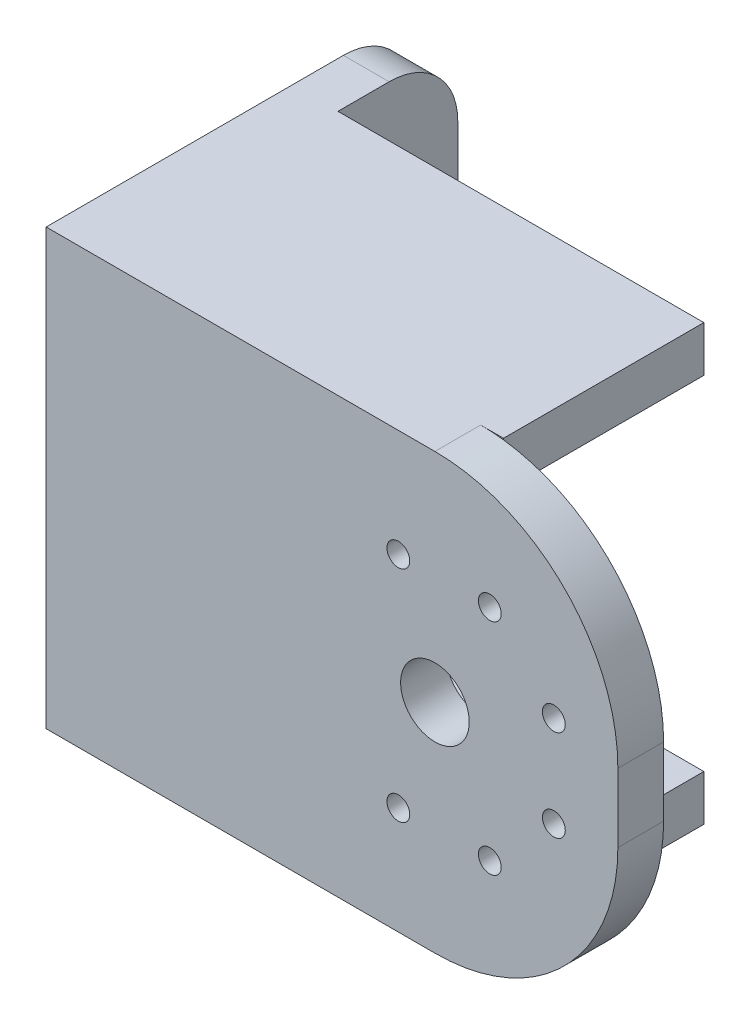
from build123d import *

# Parameters (mm, degrees)
SKETCH3_R           = 7.5
SKETCH3_R_2         = 2.5
BOSS_EXTRUDE1_DEPTH = 10
SKETCH4_W           = 10
SKETCH4_H           = 95
BOSS_EXTRUDE2_DEPTH = 70
SKETCH5_W           = 80
SKETCH5_H           = 10
BOSS_EXTRUDE3_DEPTH = 43.8
SKETCH6_W           = 32
SKETCH6_H           = 36
CUT_EXTRUDE1_DEPTH  = 43.8
FILLET2_R           = 15
SKETCH8_R           = 7.5
SKETCH8_R_2         = 2.5
CUT_EXTRUDE2_DEPTH  = 43.8


with BuildPart() as part:
    # Sketch3 → Boss-Extrude1 (new body)
    with BuildSketch(Plane.XY):
        with BuildLine():
            Line((68.617133813, 80.05993294), (153.617133813, 80.05993294))
            ThreePointArc((153.617133813, 80.05993294), (181.90140506, 68.344204188), (193.617133813, 40.05993294))
            Line((193.617133813, 40.05993294), (193.617133813, 25.05993294))
            ThreePointArc((193.617133813, 25.05993294), (181.90140506, -3.224338307), (153.617133813, -14.94006706))
            Line((153.617133813, -14.94006706), (68.617133813, -14.94006706))
            Line((68.617133813, -14.94006706), (68.617133813, 80.05993294))
        make_face()
        with Locations((153.617133813, 32.55993294)):
            Circle(SKETCH3_R, mode=Mode.SUBTRACT)
        with Locations((179.617133813, 42.55993294)):
            Circle(SKETCH3_R_2, mode=Mode.SUBTRACT)
        with Locations((145.617133813, 56.55993294)):
            Circle(SKETCH3_R_2, mode=Mode.SUBTRACT)
        with Locations((165.617133813, 56.55993294)):
            Circle(SKETCH3_R_2, mode=Mode.SUBTRACT)
        with Locations((145.617133813, 8.55993294)):
            Circle(SKETCH3_R_2, mode=Mode.SUBTRACT)
        with Locations((165.617133813, 8.55993294)):
            Circle(SKETCH3_R_2, mode=Mode.SUBTRACT)
        with Locations((179.617133813, 22.55993294)):
            Circle(SKETCH3_R_2, mode=Mode.SUBTRACT)
    extrude(amount=BOSS_EXTRUDE1_DEPTH)

    # Sketch4 → Boss-Extrude2 (add)
    with BuildSketch(Plane(origin=(0, 0, 0), x_dir=(-1, 0, 0), z_dir=(0, 0, -1))):
        with Locations((-73.617133813, 32.55993294)):
            Rectangle(SKETCH4_W, SKETCH4_H)
    extrude(amount=BOSS_EXTRUDE2_DEPTH)

    # Sketch5 → Boss-Extrude3 (add)
    with BuildSketch(Plane(origin=(0, 0, 0), x_dir=(-1, 0, 0), z_dir=(0, 0, -1))):
        with Locations((-118.617133813, 75.05993294)):
            Rectangle(SKETCH5_W, SKETCH5_H)
        with Locations((-118.617133813, -9.94006706)):
            Rectangle(SKETCH5_W, SKETCH5_H)
    extrude(amount=BOSS_EXTRUDE3_DEPTH)

    # Sketch6 → Cut-Extrude1 (cut)
    with BuildSketch(Plane.XZ.offset(14.94006706)):
        with Locations((94.617133813, -18)):
            Rectangle(SKETCH6_W, SKETCH6_H)
    extrude(amount=-CUT_EXTRUDE1_DEPTH, mode=Mode.SUBTRACT)

    # Fillet2
    fillet2_edges = [part.edges().sort_by_distance(p)[0] for p in [
        (73.617133813, 80.05993294, -70),
        (73.617133813, -14.94006706, -70),
    ]]
    fillet(fillet2_edges, radius=FILLET2_R)

    # Sketch8 → Cut-Extrude2 (cut)
    with BuildSketch(Plane.ZY.offset(-68.617133813)):
        with Locations((-40, 32.55993294)):
            Circle(SKETCH8_R)
        with Locations((-56.167891819, 25.862972874)):
            Circle(SKETCH8_R_2)
        with Locations((-56.167891819, 39.256893006)):
            Circle(SKETCH8_R_2)
        with Locations((-46.696960066, 48.727824759)):
            Circle(SKETCH8_R_2)
        with Locations((-33.303039934, 48.727824759)):
            Circle(SKETCH8_R_2)
        with Locations((-23.832108181, 39.256893006)):
            Circle(SKETCH8_R_2)
        with Locations((-23.832108181, 25.862972874)):
            Circle(SKETCH8_R_2)
        with Locations((-33.303039934, 16.392041121)):
            Circle(SKETCH8_R_2)
        with Locations((-46.696960066, 16.392041121)):
            Circle(SKETCH8_R_2)
    extrude(amount=-CUT_EXTRUDE2_DEPTH, mode=Mode.SUBTRACT)


solid = part.part
